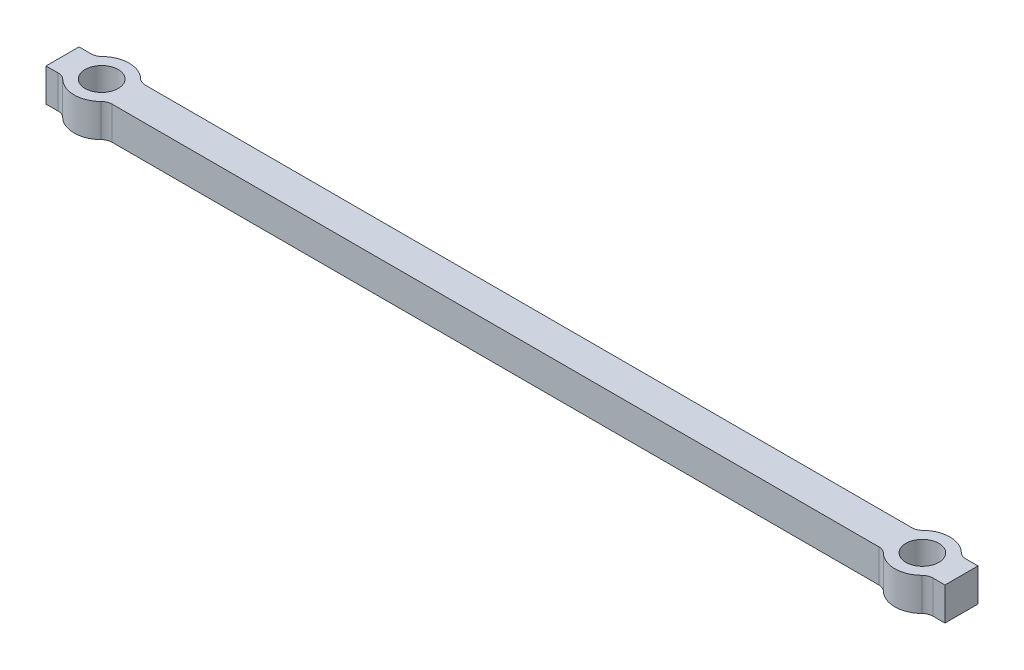
from build123d import *

# Parameters (mm, degrees)
SKETCH1_R      = 1.5
SHAPE_DEPTH    = 3
MILL_FILLETS_R = 1


with BuildPart() as part:
    # Sketch1 → Shape (new body)
    with BuildSketch(Plane(origin=(0, 0, 0), x_dir=(1, 0, 0), z_dir=(0, 1, 0))):
        with BuildLine():
            ThreePointArc((-35.25, 1.5), (-37.25, 2.5), (-39.25, 1.5))
            Line((-39.25, 1.5), (-40.8, 1.5))
            Line((-40.8, 1.5), (-40.8, -1.5))
            Line((-40.8, -1.5), (-39.25, -1.5))
            ThreePointArc((-39.25, -1.5), (-37.25, -2.5), (-35.25, -1.5))
            Line((-35.25, -1.5), (35.25, -1.5))
            ThreePointArc((35.25, -1.5), (37.25, -2.5), (39.25, -1.5))
            Line((39.25, -1.5), (40.8, -1.5))
            Line((40.8, -1.5), (40.8, 1.5))
            Line((40.8, 1.5), (39.25, 1.5))
            ThreePointArc((39.25, 1.5), (37.25, 2.5), (35.25, 1.5))
            Line((35.25, 1.5), (-35.25, 1.5))
        make_face()
        with Locations((-37.25, 0)):
            Circle(SKETCH1_R, mode=Mode.SUBTRACT)
        with Locations((37.25, 0)):
            Circle(SKETCH1_R, mode=Mode.SUBTRACT)
    extrude(amount=SHAPE_DEPTH)

    # Mill fillets
    mill_fillets_edges = [part.edges().sort_by_distance(p)[0] for p in [
        (39.25, 1.5, -1.5),
        (-35.25, 1.5, -1.5),
        (-39.25, 1.5, -1.5),
        (35.25, 1.5, -1.5),
        (-39.25, 1.5, 1.5),
        (35.25, 1.5, 1.5),
        (39.25, 1.5, 1.5),
        (-35.25, 1.5, 1.5),
    ]]
    fillet(mill_fillets_edges, radius=MILL_FILLETS_R)


solid = part.part
